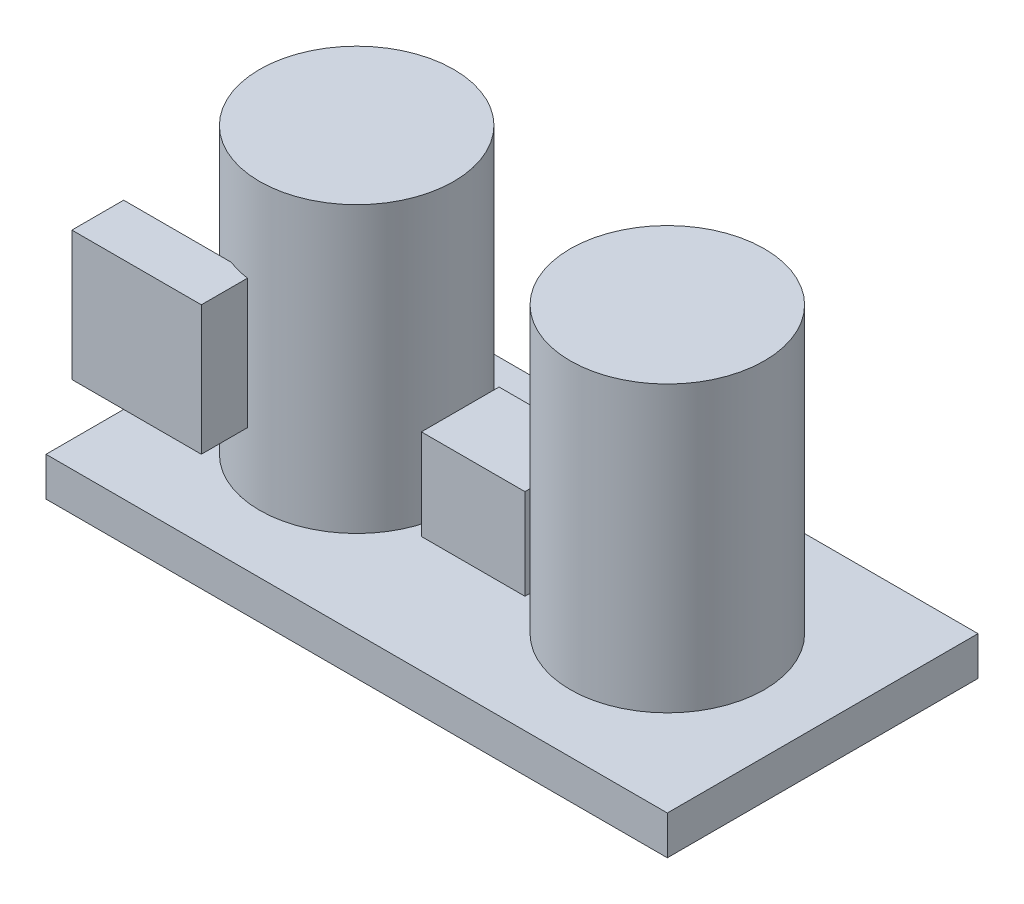
from build123d import *

# Parameters (mm, degrees)
SKETCH1_W           = 2400
SKETCH1_H           = 1200
BOSS_EXTRUDE1_DEPTH = 150
BOSS_EXTRUDE2_START = 150
SKETCH2_R           = 375
BOSS_EXTRUDE2_DEPTH = 1100
BOSS_EXTRUDE3_START = 150
SKETCH3_R           = 375
BOSS_EXTRUDE3_DEPTH = 1100
BOSS_EXTRUDE4_START = 150
SKETCH4_W           = 400
SKETCH4_H           = 300
BOSS_EXTRUDE4_DEPTH = 350
BOSS_EXTRUDE5_START = 400
SKETCH5_W           = 500
SKETCH5_H           = 200
BOSS_EXTRUDE5_DEPTH = 500
BOSS_EXTRUDE6_START = 350
SKETCH6_R           = 35
BOSS_EXTRUDE6_DEPTH = 250


with BuildPart() as part:
    # Sketch1 → Boss-Extrude1 (new body)
    with BuildSketch(Plane(origin=(0, 0, 0), x_dir=(1, 0, 0), z_dir=(0, 1, 0))):
        with Locations((-3500, 1000)):
            Rectangle(SKETCH1_W, SKETCH1_H)
    extrude(amount=BOSS_EXTRUDE1_DEPTH)

    # Sketch2 → Boss-Extrude2 (add)
    with BuildSketch(Plane(origin=(0, 0, 0), x_dir=(1, 0, 0), z_dir=(0, 1, 0)).offset(BOSS_EXTRUDE2_START)):
        with Locations((-4100, 1000)):
            Circle(SKETCH2_R)
    extrude(amount=BOSS_EXTRUDE2_DEPTH)

    # Sketch3 → Boss-Extrude3 (add)
    with BuildSketch(Plane(origin=(0, 0, 0), x_dir=(1, 0, 0), z_dir=(0, 1, 0)).offset(BOSS_EXTRUDE3_START)):
        with Locations((-2900, 1000)):
            Circle(SKETCH3_R)
    extrude(amount=BOSS_EXTRUDE3_DEPTH)

    # Sketch4 → Boss-Extrude4 (add)
    with BuildSketch(Plane(origin=(0, 0, 0), x_dir=(1, 0, 0), z_dir=(0, 1, 0)).offset(BOSS_EXTRUDE4_START)):
        with Locations((-3500, 1000)):
            Rectangle(SKETCH4_W, SKETCH4_H)
    extrude(amount=BOSS_EXTRUDE4_DEPTH)

    # Sketch5 → Boss-Extrude5 (add)
    with BuildSketch(Plane(origin=(0, 0, 0), x_dir=(1, 0, 0), z_dir=(0, 1, 0)).offset(BOSS_EXTRUDE5_START)):
        with Locations((-4400, 550)):
            Rectangle(SKETCH5_W, SKETCH5_H)
    extrude(amount=BOSS_EXTRUDE5_DEPTH)


with BuildPart() as body_2:
    # Sketch6 → Boss-Extrude6 (new body)
    with BuildSketch(Plane(origin=(0, 0, 0), x_dir=(1, 0, 0), z_dir=(0, 1, 0)).offset(BOSS_EXTRUDE6_START)):
        with Locations((-3500, 1300)):
            Circle(SKETCH6_R)
    extrude(amount=BOSS_EXTRUDE6_DEPTH)


solid = Compound([part.part, body_2.part])
